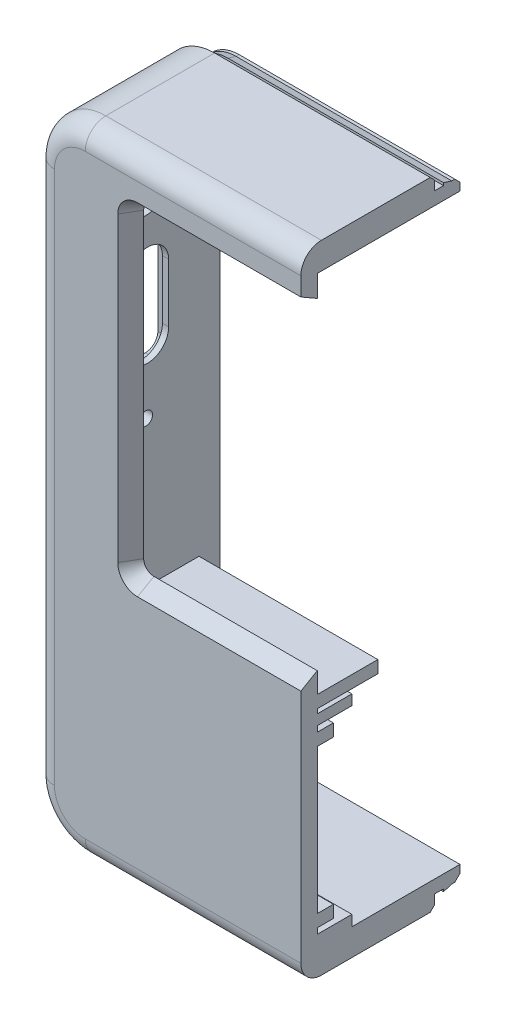
from build123d import *

# Parameters (mm, degrees)
BODY_DEPTH              = 13
ROUND_FRONT_R           = 2
CAVITY_DEPTH            = 11.4
LIP_START               = -2.5
LIP_DEPTH               = 2.5
LIP_CHAMFER_SIZE        = 0.5
BEAD_DEPTH              = 0.8
BEAD_DRAFT              = -17.354024636
SCREEN_WINDOW_DEPTH     = 1.9
SCREEN_WINDOW_DRAFT     = -30
BOARD_FENCE_SK6_W       = 1.2
BOARD_FENCE_SK6_H       = 31.02
BOARD_FENCE_SK6_W_2     = 42.22
BOARD_FENCE_SK6_H_2     = 1.2
BOARD_FENCE_DEPTH       = 5.9
TP_RAILS_SK7_W          = 25
TP_RAILS_SK7_H          = 1.2
TP_RAILS_DEPTH          = 1.57
TP_FENCE_SK8_W          = 24
TP_FENCE_SK8_H          = 1
TP_FENCE_SK8_W_2        = 1
TP_FENCE_SK8_H_2        = 15.3
TP_FENCE_SK8_H_3        = 1.05
TP_FENCE_DEPTH          = 3.37
CELL_RIBS_SK9_W         = 1.2
CELL_RIBS_SK9_H         = 12
CELL_RIBS_DEPTH         = 9.05
MAX_RELIEF_DEPTH        = 0.9
MAX_WINDOW_DEPTH        = 1.8
MAX_WINDOW_CHAMFER_SIZE = 1
MAX_LEDGES_SK12_W       = 1.6
MAX_LEDGES_SK12_H       = 1.6
MAX_LEDGES_DEPTH        = 1.3
MAX_FENCE_DEPTH         = 2.6
USB_RECESS_DEPTH        = 2
LEFT_PORTS_SK15_R       = 1.8
LEFT_PORTS_SK15_R_2     = 0.65
LEFT_PORTS_DEPTH        = 3.2
BUZZER_KEEPER_SK16_W    = 1.2
BUZZER_KEEPER_SK16_H    = 8
BUZZER_KEEPER_DEPTH     = 14.8
MIC_KEEPER_SK17_W       = 6
MIC_KEEPER_SK17_H       = 1.2
MIC_KEEPER_DEPTH        = 13.5
SEAM_SHADOW_SIZE        = 0.4
PRY_NOTCH_SK18_W        = 8
PRY_NOTCH_SK18_H        = 1.8
PRY_NOTCH_DEPTH         = 1.2
FITTEST_TRIM_DEPTH      = 62.073398464
FITTEST_TRIM_DEPTH_BACK = 62.073398464
FITTEST_SK_W            = 120
FITTEST_SK_H            = 120


with BuildPart() as part:
    # Body_Sk1 → Body (new body)
    with BuildSketch(Plane.XY):
        with BuildLine():
            Line((-45, -31), (45, -31))
            ThreePointArc((45, -31), (48.535533906, -29.535533906), (50, -26))
            Line((50, -26), (50, 26))
            ThreePointArc((50, 26), (48.535533906, 29.535533906), (45, 31))
            Line((45, 31), (-45, 31))
            ThreePointArc((-45, 31), (-48.535533906, 29.535533906), (-50, 26))
            Line((-50, 26), (-50, -26))
            ThreePointArc((-50, -26), (-48.535533906, -29.535533906), (-45, -31))
        make_face()
    extrude(amount=-BODY_DEPTH)

    # Round_Front
    round_front_edges = [part.edges().sort_by_distance(p)[0] for p in [
        (50, 0, 0),
        (48.535533906, -29.535533906, 0),
        (0, -31, 0),
        (-48.535533906, -29.535533906, 0),
        (-50, 0, 0),
        (-48.535533906, 29.535533906, 0),
        (0, 31, 0),
        (48.535533906, 29.535533906, 0),
    ]]
    fillet(round_front_edges, radius=ROUND_FRONT_R)

    # Cavity_Sk2 → Cavity (cut)
    with BuildSketch(Plane.XY.offset(-13)):
        with BuildLine():
            Line((-45, -28.4), (45, -28.4))
            ThreePointArc((45, -28.4), (46.697056275, -27.697056275), (47.4, -26))
            Line((47.4, -26), (47.4, 26))
            ThreePointArc((47.4, 26), (46.697056275, 27.697056275), (45, 28.4))
            Line((45, 28.4), (-45, 28.4))
            ThreePointArc((-45, 28.4), (-46.697056275, 27.697056275), (-47.4, 26))
            Line((-47.4, 26), (-47.4, -26))
            ThreePointArc((-47.4, -26), (-46.697056275, -27.697056275), (-45, -28.4))
        make_face()
    extrude(amount=CAVITY_DEPTH, mode=Mode.SUBTRACT)

    # Lip_Sk3 → Lip (add)
    with BuildSketch(Plane.XY.offset(-13).offset(LIP_START)):
        with BuildLine():
            Line((-45, -29.66), (45, -29.66))
            ThreePointArc((45, -29.66), (47.588010819, -28.588010819), (48.66, -26))
            Line((48.66, -26), (48.66, 26))
            ThreePointArc((48.66, 26), (47.588010819, 28.588010819), (45, 29.66))
            Line((45, 29.66), (-45, 29.66))
            ThreePointArc((-45, 29.66), (-47.588010819, 28.588010819), (-48.66, 26))
            Line((-48.66, 26), (-48.66, -26))
            ThreePointArc((-48.66, -26), (-47.588010819, -28.588010819), (-45, -29.66))
        make_face()
        with BuildLine():
            Line((-45, -28.4), (45, -28.4))
            ThreePointArc((45, -28.4), (46.697056275, -27.697056275), (47.4, -26))
            Line((47.4, -26), (47.4, 26))
            ThreePointArc((47.4, 26), (46.697056275, 27.697056275), (45, 28.4))
            Line((45, 28.4), (-45, 28.4))
            ThreePointArc((-45, 28.4), (-46.697056275, 27.697056275), (-47.4, 26))
            Line((-47.4, 26), (-47.4, -26))
            ThreePointArc((-47.4, -26), (-46.697056275, -27.697056275), (-45, -28.4))
        make_face(mode=Mode.SUBTRACT)
    extrude(amount=LIP_DEPTH)

    # Lip_Chamfer
    lip_chamfer_edges = [part.edges().sort_by_distance(p)[0] for p in [
        (-47.588010819, -28.588010819, -15.5),
        (-48.66, 0, -15.5),
        (-47.588010819, 28.588010819, -15.5),
        (0, 29.66, -15.5),
        (47.588010819, 28.588010819, -15.5),
        (48.66, 0, -15.5),
        (47.588010819, -28.588010819, -15.5),
        (0, -29.66, -15.5),
    ]]
    chamfer(lip_chamfer_edges, length=LIP_CHAMFER_SIZE)


with BuildPart() as bead_tool:
    # Bead_Sk4 → Bead (with draft: the straight prism first)
    with BuildSketch(Plane.XY.offset(-13.9)):
        with BuildLine():
            Line((-45, -29.91), (45, -29.91))
            ThreePointArc((45, -29.91), (47.764787514, -28.764787514), (48.91, -26))
            Line((48.91, -26), (48.91, 26))
            ThreePointArc((48.91, 26), (47.764787514, 28.764787514), (45, 29.91))
            Line((45, 29.91), (-45, 29.91))
            ThreePointArc((-45, 29.91), (-47.764787514, 28.764787514), (-48.91, 26))
            Line((-48.91, 26), (-48.91, -26))
            ThreePointArc((-48.91, -26), (-47.764787514, -28.764787514), (-45, -29.91))
        make_face()
        with BuildLine():
            Line((-45, -29.06), (45, -29.06))
            ThreePointArc((45, -29.06), (47.16374675, -28.16374675), (48.06, -26))
            Line((48.06, -26), (48.06, 26))
            ThreePointArc((48.06, 26), (47.16374675, 28.16374675), (45, 29.06))
            Line((45, 29.06), (-45, 29.06))
            ThreePointArc((-45, 29.06), (-47.16374675, 28.16374675), (-48.06, 26))
            Line((-48.06, 26), (-48.06, -26))
            ThreePointArc((-48.06, -26), (-47.16374675, -28.16374675), (-45, -29.06))
        make_face(mode=Mode.SUBTRACT)
    extrude(amount=-BEAD_DEPTH)
    # Bead: the draft: its side faces are tilted about the plane it starts from
    bead_sides = [bead_tool.faces().sort_by_distance(p)[0] for p in [
        (0, -29.91, -14.3),
        (47.764787514, -28.764787514, -14.3),
        (48.91, 0, -14.3),
        (47.764787514, 28.764787514, -14.3),
        (0, 29.91, -14.3),
        (-47.764787514, 28.764787514, -14.3),
        (-48.91, 0, -14.3),
        (-47.764787514, -28.764787514, -14.3),
        (-47.16374675, -28.16374675, -14.3),
        (-48.06, 0, -14.3),
        (-47.16374675, 28.16374675, -14.3),
        (0, 29.06, -14.3),
        (47.16374675, 28.16374675, -14.3),
        (48.06, 0, -14.3),
        (47.16374675, -28.16374675, -14.3),
        (0, -29.06, -14.3),
    ]]
    draft(bead_sides, Plane.XY.offset(-13.9), BEAD_DRAFT)


with BuildPart() as part_1:
    add(part.part)

    # Bead: add bead_tool
    add(bead_tool.part)


with BuildPart() as screen_window_tool:
    # Screen_Window_Sk5 → Screen_Window (with draft: the straight prism first)
    with BuildSketch(Plane.XY):
        with BuildLine():
            Line((-39.91, -6.033760431), (-0.31, -6.033760431))
            ThreePointArc((-0.31, -6.033760431), (1.050304046, -5.470304046), (1.613760431, -4.11))
            Line((1.613760431, -4.11), (1.613760431, 25.29))
            ThreePointArc((1.613760431, 25.29), (1.050304046, 26.650304046), (-0.31, 27.213760431))
            Line((-0.31, 27.213760431), (-39.91, 27.213760431))
            ThreePointArc((-39.91, 27.213760431), (-41.270304046, 26.650304046), (-41.833760431, 25.29))
            Line((-41.833760431, 25.29), (-41.833760431, -4.11))
            ThreePointArc((-41.833760431, -4.11), (-41.270304046, -5.470304046), (-39.91, -6.033760431))
        make_face()
    extrude(amount=-SCREEN_WINDOW_DEPTH)
    # Screen_Window: the draft: its side faces are tilted about the plane it starts from
    screen_window_sides = [screen_window_tool.faces().sort_by_distance(p)[0] for p in [
        (-20.11, -6.033760431, -0.95),
        (1.050304046, -5.470304046, -0.95),
        (1.613760431, 10.59, -0.95),
        (1.050304046, 26.650304046, -0.95),
        (-20.11, 27.213760431, -0.95),
        (-41.270304046, 26.650304046, -0.95),
        (-41.833760431, 10.59, -0.95),
        (-41.270304046, -5.470304046, -0.95),
    ]]
    draft(screen_window_sides, Plane.XY, SCREEN_WINDOW_DRAFT)


with BuildPart() as part_2:
    add(part_1.part)

    # Screen_Window: cut by screen_window_tool
    add(screen_window_tool.part, mode=Mode.SUBTRACT)

    # Board_Fence_Sk6 → Board_Fence (add)
    with BuildSketch(Plane.XY.offset(-1.6)):
        with Locations((3.1, 11.59)):
            Rectangle(BOARD_FENCE_SK6_W, BOARD_FENCE_SK6_H)
        with Locations((-20.31, -7.72)):
            Rectangle(BOARD_FENCE_SK6_W_2, BOARD_FENCE_SK6_H_2)
    extrude(amount=-BOARD_FENCE_DEPTH)

    # TP_Rails_Sk7 → TP_Rails (add)
    with BuildSketch(Plane.XY.offset(-1.6)):
        with Locations((-33.2, -26.2)):
            Rectangle(TP_RAILS_SK7_W, TP_RAILS_SK7_H)
        with Locations((-33.2, -10.9)):
            Rectangle(TP_RAILS_SK7_W, TP_RAILS_SK7_H)
    extrude(amount=-TP_RAILS_DEPTH)

    # TP_Fence_Sk8 → TP_Fence (add)
    with BuildSketch(Plane.XY.offset(-1.6)):
        with Locations((-31.2, -9.25)):
            Rectangle(TP_FENCE_SK8_W, TP_FENCE_SK8_H)
        with Locations((-18.4, -18.55)):
            Rectangle(TP_FENCE_SK8_W_2, TP_FENCE_SK8_H_2)
        with Locations((-31.2, -27.875)):
            Rectangle(TP_FENCE_SK8_W, TP_FENCE_SK8_H_3)
    extrude(amount=-TP_FENCE_DEPTH)

    # Cell_Ribs_Sk9 → Cell_Ribs (add)
    with BuildSketch(Plane.XY.offset(-1.6)):
        with Locations((-10, -18.05)):
            Rectangle(CELL_RIBS_SK9_W, CELL_RIBS_SK9_H)
        with Locations((8, -18.05)):
            Rectangle(CELL_RIBS_SK9_W, CELL_RIBS_SK9_H)
        with Locations((22, -18.05)):
            Rectangle(CELL_RIBS_SK9_W, CELL_RIBS_SK9_H)
    extrude(amount=-CELL_RIBS_DEPTH)

    # MAX_Relief_Sk10 → MAX_Relief (cut)
    with BuildSketch(Plane.XY.offset(-1.6)):
        with BuildLine():
            Line((20.35, 3.85), (37.65, 3.85))
            ThreePointArc((37.65, 3.85), (38.357106781, 4.142893219), (38.65, 4.85))
            Line((38.65, 4.85), (38.65, 17.15))
            ThreePointArc((38.65, 17.15), (38.357106781, 17.857106781), (37.65, 18.15))
            Line((37.65, 18.15), (20.35, 18.15))
            ThreePointArc((20.35, 18.15), (19.642893219, 17.857106781), (19.35, 17.15))
            Line((19.35, 17.15), (19.35, 4.85))
            ThreePointArc((19.35, 4.85), (19.642893219, 4.142893219), (20.35, 3.85))
        make_face()
    extrude(amount=MAX_RELIEF_DEPTH, mode=Mode.SUBTRACT)

    # MAX_Window_Sk11 → MAX_Window (cut)
    with BuildSketch(Plane.XY):
        with BuildLine():
            Line((26, 7), (32, 7))
            ThreePointArc((32, 7), (33.414213562, 7.585786438), (34, 9))
            Line((34, 9), (34, 13))
            ThreePointArc((34, 13), (33.414213562, 14.414213562), (32, 15))
            Line((32, 15), (26, 15))
            ThreePointArc((26, 15), (24.585786438, 14.414213562), (24, 13))
            Line((24, 13), (24, 9))
            ThreePointArc((24, 9), (24.585786438, 7.585786438), (26, 7))
        make_face()
    extrude(amount=-MAX_WINDOW_DEPTH, mode=Mode.SUBTRACT)

    # MAX_Window_Chamfer
    # the kernel refuses this chamfer: 1 mm, written as the material it takes off along each edge
    with BuildSketch(Plane(origin=(26, 9, 0), x_dir=(-1, 0, 0), z_dir=(0, 1, 0))) as max_window_chamfer_piece_1:
        Polygon((2 + MAX_WINDOW_CHAMFER_SIZE, 0), (2, -MAX_WINDOW_CHAMFER_SIZE), (2, 0), align=None)
    revolve(axis=Axis((26, 9, 0), (0, 0, 1)), revolution_arc=90, mode=Mode.SUBTRACT)
    with BuildSketch(Plane(origin=(26, 7, 0), x_dir=(0, -0.9996219169112968, 0.027495876610586365), z_dir=(1, 0, 0)), Plane(origin=(32, 15, 0), x_dir=(0, 0.9996219169112968, 0.02749587661058639), z_dir=(-1, 0, 0))) as max_window_chamfer_piece_2:
        Polygon((MAX_WINDOW_CHAMFER_SIZE * 0.999621916911, MAX_WINDOW_CHAMFER_SIZE * 0.0274958766106), (-MAX_WINDOW_CHAMFER_SIZE * 0.0274958766106, MAX_WINDOW_CHAMFER_SIZE * 0.999621916911), (0, 0), align=None)
    extrude(amount=6, mode=Mode.SUBTRACT)
    with BuildSketch(Plane(origin=(32, 9, 0), x_dir=(0, -1, 0), z_dir=(-1, 0, 0))) as max_window_chamfer_piece_3:
        Polygon((2 + MAX_WINDOW_CHAMFER_SIZE, 0), (2, -MAX_WINDOW_CHAMFER_SIZE), (2, 0), align=None)
    revolve(axis=Axis((32, 9, 0), (0, 0, 1)), revolution_arc=90, mode=Mode.SUBTRACT)
    with BuildSketch(Plane(origin=(34, 9, 0), x_dir=(0.9996219169112968, 0, 0.027495876610586292), z_dir=(0, 1, 0)), Plane(origin=(24, 13, 0), x_dir=(-0.9996219169112968, 0, 0.02749587661058639), z_dir=(0, -1, 0))) as max_window_chamfer_piece_4:
        Polygon((MAX_WINDOW_CHAMFER_SIZE * 0.999621916911, MAX_WINDOW_CHAMFER_SIZE * 0.0274958766106), (-MAX_WINDOW_CHAMFER_SIZE * 0.0274958766106, MAX_WINDOW_CHAMFER_SIZE * 0.999621916911), (0, 0), align=None)
    extrude(amount=4, mode=Mode.SUBTRACT)
    with BuildSketch(Plane(origin=(32, 13, 0), x_dir=(1, 0, 0), z_dir=(0, -1, 0))) as max_window_chamfer_piece_5:
        Polygon((2 + MAX_WINDOW_CHAMFER_SIZE, 0), (2, -MAX_WINDOW_CHAMFER_SIZE), (2, 0), align=None)
    revolve(axis=Axis((32, 13, 0), (0, 0, 1)), revolution_arc=90, mode=Mode.SUBTRACT)
    with BuildSketch(Plane(origin=(26, 13, 0), x_dir=(0, 1, 0), z_dir=(1, 0, 0))) as max_window_chamfer_piece_6:
        Polygon((2 + MAX_WINDOW_CHAMFER_SIZE, 0), (2, -MAX_WINDOW_CHAMFER_SIZE), (2, 0), align=None)
    revolve(axis=Axis((26, 13, 0), (0, 0, 1)), revolution_arc=90, mode=Mode.SUBTRACT)

    # MAX_Ledges_Sk12 → MAX_Ledges (add)
    with BuildSketch(Plane.XY.offset(-0.7)):
        with Locations((19.45, 3.95)):
            Rectangle(MAX_LEDGES_SK12_W, MAX_LEDGES_SK12_H)
        with Locations((19.45, 18.05)):
            Rectangle(MAX_LEDGES_SK12_W, MAX_LEDGES_SK12_H)
        with Locations((38.55, 3.95)):
            Rectangle(MAX_LEDGES_SK12_W, MAX_LEDGES_SK12_H)
        with Locations((38.55, 18.05)):
            Rectangle(MAX_LEDGES_SK12_W, MAX_LEDGES_SK12_H)
    extrude(amount=-MAX_LEDGES_DEPTH)

    # MAX_Fence_Sk13 → MAX_Fence (add)
    with BuildSketch(Plane.XY.offset(-1.6)):
        Polygon((17.45, 20.05), (37.35, 20.05), (37.35, 18.85), (18.65, 18.85), (18.65, 3.15), (37.35, 3.15), (37.35, 1.95), (17.45, 1.95), align=None)
    extrude(amount=-MAX_FENCE_DEPTH)

    # USB_Recess_Sk14 → USB_Recess (cut)
    with BuildSketch(Plane(origin=(-50, 0, 0), x_dir=(0, 0, -1), z_dir=(1, 0, 0))):
        with BuildLine():
            Line((12.07, 5.29), (12.07, 15.89))
            ThreePointArc((12.07, 15.89), (11.718528137, 16.738528137), (10.87, 17.09))
            Line((10.87, 17.09), (6.07, 17.09))
            ThreePointArc((6.07, 17.09), (5.221471863, 16.738528137), (4.87, 15.89))
            Line((4.87, 15.89), (4.87, 5.29))
            ThreePointArc((4.87, 5.29), (5.221471863, 4.441471863), (6.07, 4.09))
            Line((6.07, 4.09), (10.87, 4.09))
            ThreePointArc((10.87, 4.09), (11.718528137, 4.441471863), (12.07, 5.29))
        make_face()
        with BuildLine():
            Line((9.6, -23.85), (9.6, -13.25))
            ThreePointArc((9.6, -13.25), (9.248528137, -12.401471863), (8.4, -12.05))
            Line((8.4, -12.05), (3.6, -12.05))
            ThreePointArc((3.6, -12.05), (2.751471863, -12.401471863), (2.4, -13.25))
            Line((2.4, -13.25), (2.4, -23.85))
            ThreePointArc((2.4, -23.85), (2.751471863, -24.698528137), (3.6, -25.05))
            Line((3.6, -25.05), (8.4, -25.05))
            ThreePointArc((8.4, -25.05), (9.248528137, -24.698528137), (9.6, -23.85))
        make_face()
    extrude(amount=USB_RECESS_DEPTH, mode=Mode.SUBTRACT)

    # Left_Ports_Sk15 → Left_Ports (cut)
    with BuildSketch(Plane(origin=(-50, 0, 0), x_dir=(0, 0, -1), z_dir=(1, 0, 0))):
        with Locations((8.305, 20.04)):
            Circle(LEFT_PORTS_SK15_R)
        with Locations((8.305, 1.115)):
            Circle(LEFT_PORTS_SK15_R_2)
        with BuildLine():
            Line((6.42, 7.74), (6.42, 13.44))
            ThreePointArc((6.42, 13.44), (8.47, 15.49), (10.52, 13.44))
            Line((10.52, 13.44), (10.52, 7.74))
            ThreePointArc((10.52, 7.74), (8.47, 5.69), (6.42, 7.74))
        make_face()
        with BuildLine():
            Line((3.75, -21.2), (3.75, -15.9))
            ThreePointArc((3.75, -15.9), (6, -13.65), (8.25, -15.9))
            Line((8.25, -15.9), (8.25, -21.2))
            ThreePointArc((8.25, -21.2), (6, -23.45), (3.75, -21.2))
        make_face()
    extrude(amount=LEFT_PORTS_DEPTH, mode=Mode.SUBTRACT)

    # Buzzer_Keeper_Sk16 → Buzzer_Keeper (add)
    with BuildSketch(Plane.XY.offset(-1.6)):
        with Locations((44.9, -18)):
            Rectangle(BUZZER_KEEPER_SK16_W, BUZZER_KEEPER_SK16_H)
    extrude(amount=-BUZZER_KEEPER_DEPTH)

    # Mic_Keeper_Sk17 → Mic_Keeper (add)
    with BuildSketch(Plane.XY.offset(-1.6)):
        with Locations((16, 27.8)):
            Rectangle(MIC_KEEPER_SK17_W, MIC_KEEPER_SK17_H)
    extrude(amount=-MIC_KEEPER_DEPTH)

    # Seam_Shadow
    seam_shadow_edges = [part_2.edges().sort_by_distance(p)[0] for p in [
        (48.535533906, -29.535533906, -13),
        (50, 0, -13),
        (48.535533906, 29.535533906, -13),
        (0, 31, -13),
        (-48.535533906, 29.535533906, -13),
        (-50, 0, -13),
        (-48.535533906, -29.535533906, -13),
        (0, -31, -13),
    ]]
    chamfer(seam_shadow_edges, length=SEAM_SHADOW_SIZE)

    # Pry_Notch_Sk18 → Pry_Notch (cut)
    with BuildSketch(Plane(origin=(0, -31, 0), x_dir=(1, 0, 0), z_dir=(0, 1, 0))):
        with Locations((38, 12.1)):
            Rectangle(PRY_NOTCH_SK18_W, PRY_NOTCH_SK18_H)
    extrude(amount=PRY_NOTCH_DEPTH, mode=Mode.SUBTRACT)

    # FitTest_Sk → FitTest_Trim (cut, two sides: drawn at the far end of the back side and taken through both)
    with BuildSketch(Plane.XY.offset(-FITTEST_TRIM_DEPTH_BACK)):
        with Locations((36, 0)):
            Rectangle(FITTEST_SK_W, FITTEST_SK_H)
    extrude(amount=FITTEST_TRIM_DEPTH + FITTEST_TRIM_DEPTH_BACK, mode=Mode.SUBTRACT)


solid = part_2.part
